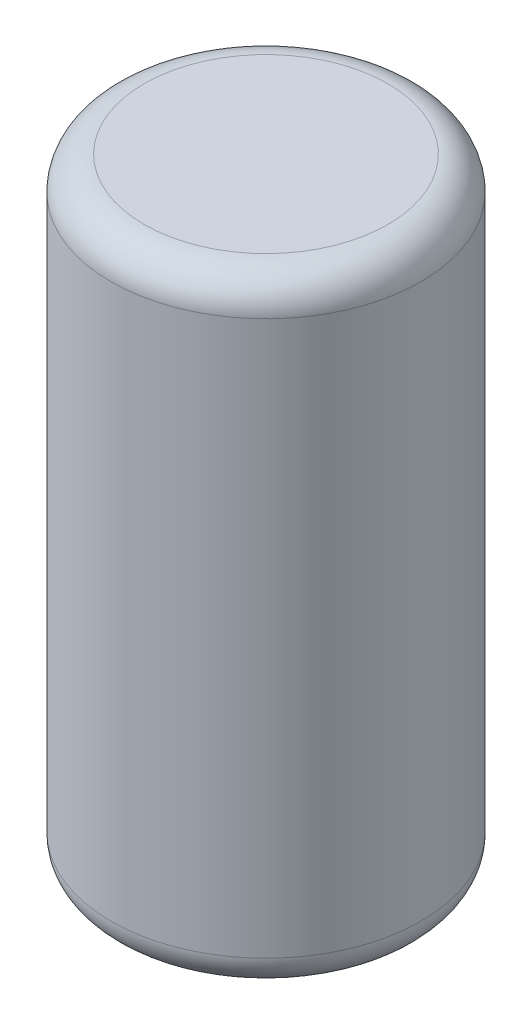
from build123d import *

# Parameters (mm, degrees)
SKETCH1_R           = 1.190625
BOSS_EXTRUDE1_DEPTH = 4.7625
FILLET2_R           = 0.254


with BuildPart() as part:
    # Sketch1 → Boss-Extrude1 (new body)
    with BuildSketch(Plane(origin=(0, 0, 0), x_dir=(1, 0, 0), z_dir=(0, 1, 0))):
        Circle(SKETCH1_R)
    extrude(amount=BOSS_EXTRUDE1_DEPTH)

    # Fillet2
    fillet2_edges = [part.edges().sort_by_distance(p)[0] for p in [
        (-1.190625, 0, 0),
        (-1.190625, 4.7625, 0),
    ]]
    fillet(fillet2_edges, radius=FILLET2_R)


solid = part.part
